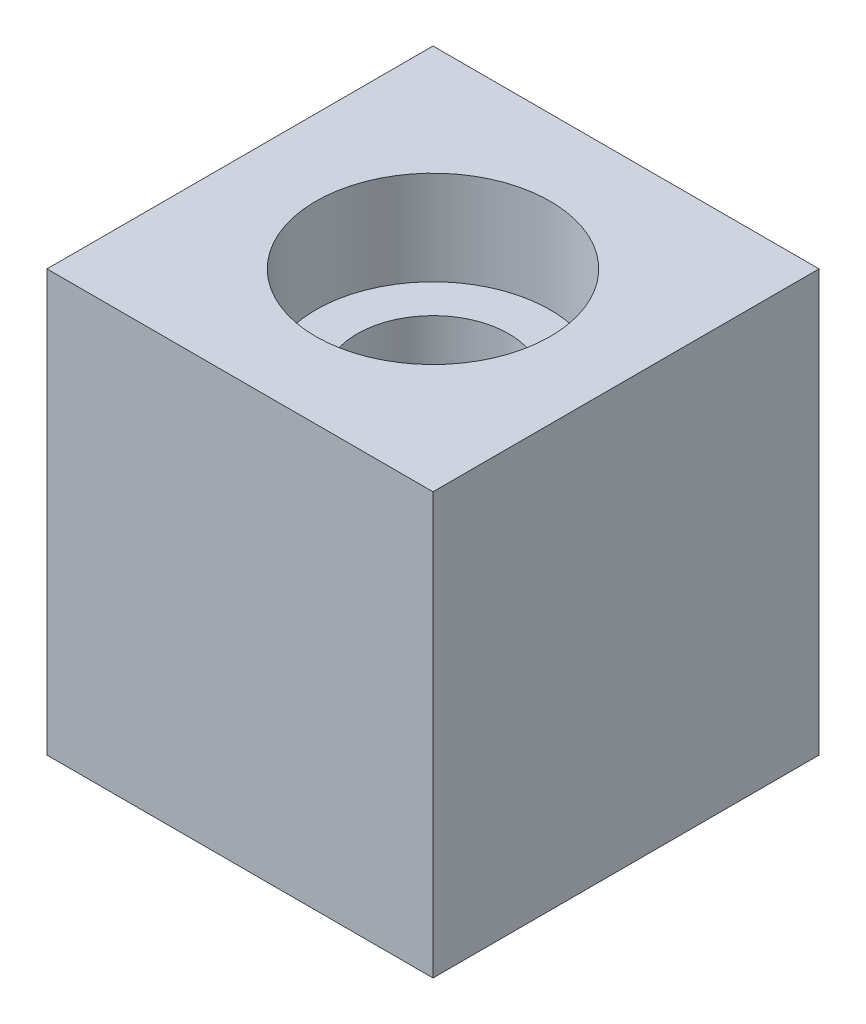
from build123d import *

# Parameters (mm, degrees)
SKETCH1_W           = 69.85
SKETCH1_H           = 69.85
BOSS_EXTRUDE1_DEPTH = 76.2
SKETCH2_R           = 13.716
CUT_EXTRUDE1_DEPTH  = 76.2
SKETCH4_R           = 21.209
CUT_EXTRUDE2_DEPTH  = 17.018
CUT_EXTRUDE3_START  = -7.62
SKETCH5_R           = 21.209
CUT_EXTRUDE3_DEPTH  = 7.62


with BuildPart() as part:
    # Sketch1 → Boss-Extrude1 (new body)
    with BuildSketch(Plane(origin=(0, 0, 0), x_dir=(1, 0, 0), z_dir=(0, 1, 0))):
        with Locations((34.925, 34.925)):
            Rectangle(SKETCH1_W, SKETCH1_H)
    extrude(amount=BOSS_EXTRUDE1_DEPTH)

    # Sketch2 → Cut-Extrude1 (cut)
    with BuildSketch(Plane(origin=(0, 76.2, 0), x_dir=(1, 0, 0), z_dir=(0, 1, 0))):
        with Locations((34.925, 34.925)):
            Circle(SKETCH2_R)
    extrude(amount=-CUT_EXTRUDE1_DEPTH, mode=Mode.SUBTRACT)

    # Sketch4 → Cut-Extrude2 (cut)
    with BuildSketch(Plane(origin=(0, 76.2, 0), x_dir=(1, 0, 0), z_dir=(0, 1, 0))):
        with Locations((34.925, 34.925)):
            Circle(SKETCH4_R)
    extrude(amount=-CUT_EXTRUDE2_DEPTH, mode=Mode.SUBTRACT)

    # Sketch5 → Cut-Extrude3 (cut)
    with BuildSketch(Plane.XZ.offset(CUT_EXTRUDE3_START)):
        with Locations((34.925, -34.925)):
            Circle(SKETCH5_R)
    extrude(amount=CUT_EXTRUDE3_DEPTH, mode=Mode.SUBTRACT)


solid = part.part
